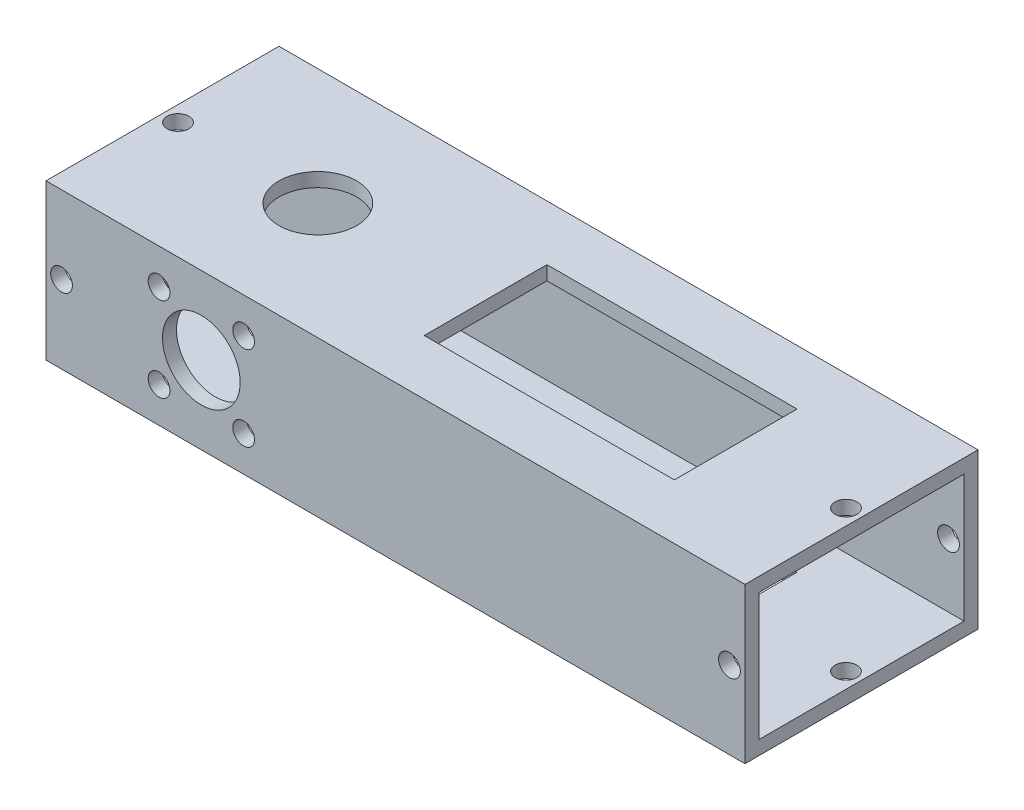
from build123d import *

# Parameters (mm, degrees)
SKETCH1_W           = 114.3
SKETCH1_H           = 38.1
BOSS_EXTRUDE1_DEPTH = 25.4
CUT_EXTRUDE1_REACH  = 125.131
SKETCH2_W           = 33.528
SKETCH2_H           = 20.828
CUT_EXTRUDE2_REACH  = 125.131
SKETCH3_R           = 1.778
CUT_EXTRUDE3_REACH  = 125.131
SKETCH4_R           = 1.778
CUT_EXTRUDE4_REACH  = 125.131
SKETCH5_R           = 1.778
SKETCH5_R_2         = 6.35
CUT_EXTRUDE5_REACH  = 125.131
SKETCH6_R           = 1.778
SKETCH6_R_2         = 6.35
CUT_EXTRUDE6_REACH  = 125.131
SKETCH7_R           = 1.778
SKETCH7_R_2         = 6.35
CUT_EXTRUDE7_REACH  = 125.131
SKETCH8_R           = 1.778
SKETCH8_R_2         = 6.35
CUT_EXTRUDE8_REACH  = 125.131
SKETCH9_R           = 1.778
CUT_EXTRUDE9_REACH  = 125.131
SKETCH10_R          = 1.778


with BuildPart() as part:
    # Sketch1 → Boss-Extrude1 (new body)
    with BuildSketch(Plane(origin=(0, 0, 0), x_dir=(1, 0, 0), z_dir=(0, 1, 0))):
        with Locations((-57.15, -19.05)):
            Rectangle(SKETCH1_W, SKETCH1_H)
    extrude(amount=BOSS_EXTRUDE1_DEPTH)

    # Sketch2 → Cut-Extrude1 (cut, up to next)
    with BuildSketch(Plane(origin=(0, 0, 0), x_dir=(0, 0, -1), z_dir=(1, 0, 0)), mode=Mode.PRIVATE) as cut_extrude1_sk1:
        with Locations((-19.05, 12.7)):
            Rectangle(SKETCH2_W, SKETCH2_H)
    cut_extrude1_tool1 = extrude(cut_extrude1_sk1.sketch, amount=-CUT_EXTRUDE1_REACH, mode=Mode.PRIVATE) & part.part
    add(cut_extrude1_tool1.solids().sort_by_distance((0, 12.7, 19.05))[0], mode=Mode.SUBTRACT)

    # Sketch3 → Cut-Extrude2 (cut, up to next)
    with BuildSketch(Plane.XY.offset(38.1), mode=Mode.PRIVATE) as cut_extrude2_sk1:
        with Locations((-2.54, 12.7)):
            Circle(SKETCH3_R)
    cut_extrude2_tool1 = extrude(cut_extrude2_sk1.sketch, amount=-CUT_EXTRUDE2_REACH, mode=Mode.PRIVATE) & part.part
    add(cut_extrude2_tool1.solids().sort_by_distance((-2.54, 12.7, 38.1))[0], mode=Mode.SUBTRACT)

    # Sketch4 → Cut-Extrude3 (cut, up to next)
    with BuildSketch(Plane(origin=(0, 0, 0), x_dir=(-1, 0, 0), z_dir=(0, 0, -1)), mode=Mode.PRIVATE) as cut_extrude3_sk1:
        with Locations((2.54, 12.7)):
            Circle(SKETCH4_R)
    cut_extrude3_tool1 = extrude(cut_extrude3_sk1.sketch, amount=-CUT_EXTRUDE3_REACH, mode=Mode.PRIVATE) & part.part
    add(cut_extrude3_tool1.solids().sort_by_distance((-2.54, 12.7, 0))[0], mode=Mode.SUBTRACT)

    # Sketch5 → Cut-Extrude4 (cut, up to next)
    with BuildSketch(Plane.XY.offset(38.1), mode=Mode.PRIVATE) as cut_extrude4_sk1:
        with Locations((-111.76, 12.7)):
            Circle(SKETCH5_R)
    cut_extrude4_tool1 = extrude(cut_extrude4_sk1.sketch, amount=-CUT_EXTRUDE4_REACH, mode=Mode.PRIVATE) & part.part
    # Sketch5 → Cut-Extrude4 (cut, up to next)
    with BuildSketch(Plane.XY.offset(38.1), mode=Mode.PRIVATE) as cut_extrude4_sk2:
        with Locations((-88.9, 12.7)):
            Circle(SKETCH5_R_2)
    cut_extrude4_tool2 = extrude(cut_extrude4_sk2.sketch, amount=-CUT_EXTRUDE4_REACH, mode=Mode.PRIVATE) & part.part
    # Sketch5 → Cut-Extrude4 (cut, up to next)
    with BuildSketch(Plane.XY.offset(38.1), mode=Mode.PRIVATE) as cut_extrude4_sk3:
        with Locations((-95.814797213, 19.614797213)):
            Circle(SKETCH5_R)
    cut_extrude4_tool3 = extrude(cut_extrude4_sk3.sketch, amount=-CUT_EXTRUDE4_REACH, mode=Mode.PRIVATE) & part.part
    # Sketch5 → Cut-Extrude4 (cut, up to next)
    with BuildSketch(Plane.XY.offset(38.1), mode=Mode.PRIVATE) as cut_extrude4_sk4:
        with Locations((-81.985202787, 19.614797213)):
            Circle(SKETCH5_R)
    cut_extrude4_tool4 = extrude(cut_extrude4_sk4.sketch, amount=-CUT_EXTRUDE4_REACH, mode=Mode.PRIVATE) & part.part
    # Sketch5 → Cut-Extrude4 (cut, up to next)
    with BuildSketch(Plane.XY.offset(38.1), mode=Mode.PRIVATE) as cut_extrude4_sk5:
        with Locations((-95.814797213, 5.785202787)):
            Circle(SKETCH5_R)
    cut_extrude4_tool5 = extrude(cut_extrude4_sk5.sketch, amount=-CUT_EXTRUDE4_REACH, mode=Mode.PRIVATE) & part.part
    # Sketch5 → Cut-Extrude4 (cut, up to next)
    with BuildSketch(Plane.XY.offset(38.1), mode=Mode.PRIVATE) as cut_extrude4_sk6:
        with Locations((-81.985202787, 5.785202787)):
            Circle(SKETCH5_R)
    cut_extrude4_tool6 = extrude(cut_extrude4_sk6.sketch, amount=-CUT_EXTRUDE4_REACH, mode=Mode.PRIVATE) & part.part
    add(cut_extrude4_tool1.solids().sort_by_distance((-111.76, 12.7, 38.1))[0], mode=Mode.SUBTRACT)
    add(cut_extrude4_tool2.solids().sort_by_distance((-88.9, 12.7, 38.1))[0], mode=Mode.SUBTRACT)
    add(cut_extrude4_tool3.solids().sort_by_distance((-95.814797, 19.614797, 38.1))[0], mode=Mode.SUBTRACT)
    add(cut_extrude4_tool4.solids().sort_by_distance((-81.985203, 19.614797, 38.1))[0], mode=Mode.SUBTRACT)
    add(cut_extrude4_tool5.solids().sort_by_distance((-95.814797, 5.785203, 38.1))[0], mode=Mode.SUBTRACT)
    add(cut_extrude4_tool6.solids().sort_by_distance((-81.985203, 5.785203, 38.1))[0], mode=Mode.SUBTRACT)

    # Sketch6 → Cut-Extrude5 (cut, up to next)
    with BuildSketch(Plane(origin=(0, 0, 0), x_dir=(-1, 0, 0), z_dir=(0, 0, -1)), mode=Mode.PRIVATE) as cut_extrude5_sk1:
        with Locations((111.76, 12.7)):
            Circle(SKETCH6_R)
    cut_extrude5_tool1 = extrude(cut_extrude5_sk1.sketch, amount=-CUT_EXTRUDE5_REACH, mode=Mode.PRIVATE) & part.part
    # Sketch6 → Cut-Extrude5 (cut, up to next)
    with BuildSketch(Plane(origin=(0, 0, 0), x_dir=(-1, 0, 0), z_dir=(0, 0, -1)), mode=Mode.PRIVATE) as cut_extrude5_sk2:
        with Locations((88.9, 12.7)):
            Circle(SKETCH6_R_2)
    cut_extrude5_tool2 = extrude(cut_extrude5_sk2.sketch, amount=-CUT_EXTRUDE5_REACH, mode=Mode.PRIVATE) & part.part
    # Sketch6 → Cut-Extrude5 (cut, up to next)
    with BuildSketch(Plane(origin=(0, 0, 0), x_dir=(-1, 0, 0), z_dir=(0, 0, -1)), mode=Mode.PRIVATE) as cut_extrude5_sk3:
        with Locations((81.985202787, 19.614797213)):
            Circle(SKETCH6_R)
    cut_extrude5_tool3 = extrude(cut_extrude5_sk3.sketch, amount=-CUT_EXTRUDE5_REACH, mode=Mode.PRIVATE) & part.part
    # Sketch6 → Cut-Extrude5 (cut, up to next)
    with BuildSketch(Plane(origin=(0, 0, 0), x_dir=(-1, 0, 0), z_dir=(0, 0, -1)), mode=Mode.PRIVATE) as cut_extrude5_sk4:
        with Locations((95.814797213, 19.614797213)):
            Circle(SKETCH6_R)
    cut_extrude5_tool4 = extrude(cut_extrude5_sk4.sketch, amount=-CUT_EXTRUDE5_REACH, mode=Mode.PRIVATE) & part.part
    # Sketch6 → Cut-Extrude5 (cut, up to next)
    with BuildSketch(Plane(origin=(0, 0, 0), x_dir=(-1, 0, 0), z_dir=(0, 0, -1)), mode=Mode.PRIVATE) as cut_extrude5_sk5:
        with Locations((95.814797213, 5.785202787)):
            Circle(SKETCH6_R)
    cut_extrude5_tool5 = extrude(cut_extrude5_sk5.sketch, amount=-CUT_EXTRUDE5_REACH, mode=Mode.PRIVATE) & part.part
    # Sketch6 → Cut-Extrude5 (cut, up to next)
    with BuildSketch(Plane(origin=(0, 0, 0), x_dir=(-1, 0, 0), z_dir=(0, 0, -1)), mode=Mode.PRIVATE) as cut_extrude5_sk6:
        with Locations((81.985202787, 5.785202787)):
            Circle(SKETCH6_R)
    cut_extrude5_tool6 = extrude(cut_extrude5_sk6.sketch, amount=-CUT_EXTRUDE5_REACH, mode=Mode.PRIVATE) & part.part
    add(cut_extrude5_tool1.solids().sort_by_distance((-111.76, 12.7, 0))[0], mode=Mode.SUBTRACT)
    add(cut_extrude5_tool2.solids().sort_by_distance((-88.9, 12.7, 0))[0], mode=Mode.SUBTRACT)
    add(cut_extrude5_tool3.solids().sort_by_distance((-81.985203, 19.614797, 0))[0], mode=Mode.SUBTRACT)
    add(cut_extrude5_tool4.solids().sort_by_distance((-95.814797, 19.614797, 0))[0], mode=Mode.SUBTRACT)
    add(cut_extrude5_tool5.solids().sort_by_distance((-95.814797, 5.785203, 0))[0], mode=Mode.SUBTRACT)
    add(cut_extrude5_tool6.solids().sort_by_distance((-81.985203, 5.785203, 0))[0], mode=Mode.SUBTRACT)

    # Sketch7 → Cut-Extrude6 (cut, up to next)
    with BuildSketch(Plane(origin=(0, 25.4, 0), x_dir=(1, 0, 0), z_dir=(0, 1, 0)), mode=Mode.PRIVATE) as cut_extrude6_sk1:
        with Locations((-111.76, -19.05)):
            Circle(SKETCH7_R)
    cut_extrude6_tool1 = extrude(cut_extrude6_sk1.sketch, amount=-CUT_EXTRUDE6_REACH, mode=Mode.PRIVATE) & part.part
    # Sketch7 → Cut-Extrude6 (cut, up to next)
    with BuildSketch(Plane(origin=(0, 25.4, 0), x_dir=(1, 0, 0), z_dir=(0, 1, 0)), mode=Mode.PRIVATE) as cut_extrude6_sk2:
        with Locations((-88.9, -19.05)):
            Circle(SKETCH7_R_2)
    cut_extrude6_tool2 = extrude(cut_extrude6_sk2.sketch, amount=-CUT_EXTRUDE6_REACH, mode=Mode.PRIVATE) & part.part
    # Sketch7 → Cut-Extrude6 (cut, up to next)
    with BuildSketch(Plane(origin=(0, 25.4, 0), x_dir=(1, 0, 0), z_dir=(0, 1, 0)), mode=Mode.PRIVATE) as cut_extrude6_sk3:
        Polygon((-61.468, -19.05), (-61.468, -9.017), (-20.574, -9.017), (-20.574, -29.083), (-61.468, -29.083), align=None)
    cut_extrude6_tool3 = extrude(cut_extrude6_sk3.sketch, amount=-CUT_EXTRUDE6_REACH, mode=Mode.PRIVATE) & part.part
    add(cut_extrude6_tool1.solids().sort_by_distance((-111.76, 25.4, 19.05))[0], mode=Mode.SUBTRACT)
    add(cut_extrude6_tool2.solids().sort_by_distance((-88.9, 25.4, 19.05))[0], mode=Mode.SUBTRACT)
    add(cut_extrude6_tool3.solids().sort_by_distance((-41.021, 25.4, 19.05))[0], mode=Mode.SUBTRACT)

    # Sketch8 → Cut-Extrude7 (cut, up to next)
    with BuildSketch(Plane.XZ, mode=Mode.PRIVATE) as cut_extrude7_sk1:
        with Locations((-111.76, 19.05)):
            Circle(SKETCH8_R)
    cut_extrude7_tool1 = extrude(cut_extrude7_sk1.sketch, amount=-CUT_EXTRUDE7_REACH, mode=Mode.PRIVATE) & part.part
    # Sketch8 → Cut-Extrude7 (cut, up to next)
    with BuildSketch(Plane.XZ, mode=Mode.PRIVATE) as cut_extrude7_sk2:
        with Locations((-88.9, 19.05)):
            Circle(SKETCH8_R_2)
    cut_extrude7_tool2 = extrude(cut_extrude7_sk2.sketch, amount=-CUT_EXTRUDE7_REACH, mode=Mode.PRIVATE) & part.part
    # Sketch8 → Cut-Extrude7 (cut, up to next)
    with BuildSketch(Plane.XZ, mode=Mode.PRIVATE) as cut_extrude7_sk3:
        Polygon((-61.468, 19.05), (-61.468, 29.083), (-20.574, 29.083), (-20.574, 9.017), (-61.468, 9.017), align=None)
    cut_extrude7_tool3 = extrude(cut_extrude7_sk3.sketch, amount=-CUT_EXTRUDE7_REACH, mode=Mode.PRIVATE) & part.part
    add(cut_extrude7_tool1.solids().sort_by_distance((-111.76, 0, 19.05))[0], mode=Mode.SUBTRACT)
    add(cut_extrude7_tool2.solids().sort_by_distance((-88.9, 0, 19.05))[0], mode=Mode.SUBTRACT)
    add(cut_extrude7_tool3.solids().sort_by_distance((-41.021, 0, 19.05))[0], mode=Mode.SUBTRACT)

    # Sketch9 → Cut-Extrude8 (cut, up to next)
    with BuildSketch(Plane(origin=(0, 25.4, 0), x_dir=(1, 0, 0), z_dir=(0, 1, 0)), mode=Mode.PRIVATE) as cut_extrude8_sk1:
        with Locations((-2.54, -19.05)):
            Circle(SKETCH9_R)
    cut_extrude8_tool1 = extrude(cut_extrude8_sk1.sketch, amount=-CUT_EXTRUDE8_REACH, mode=Mode.PRIVATE) & part.part
    add(cut_extrude8_tool1.solids().sort_by_distance((-2.54, 25.4, 19.05))[0], mode=Mode.SUBTRACT)

    # Sketch10 → Cut-Extrude9 (cut, up to next)
    with BuildSketch(Plane(origin=(0, 0, 0), x_dir=(-1, 0, 0), z_dir=(0, -1, 0)), mode=Mode.PRIVATE) as cut_extrude9_sk1:
        with Locations((2.54, -19.05)):
            Circle(SKETCH10_R)
    cut_extrude9_tool1 = extrude(cut_extrude9_sk1.sketch, amount=-CUT_EXTRUDE9_REACH, mode=Mode.PRIVATE) & part.part
    add(cut_extrude9_tool1.solids().sort_by_distance((-2.54, 0, 19.05))[0], mode=Mode.SUBTRACT)


solid = part.part
